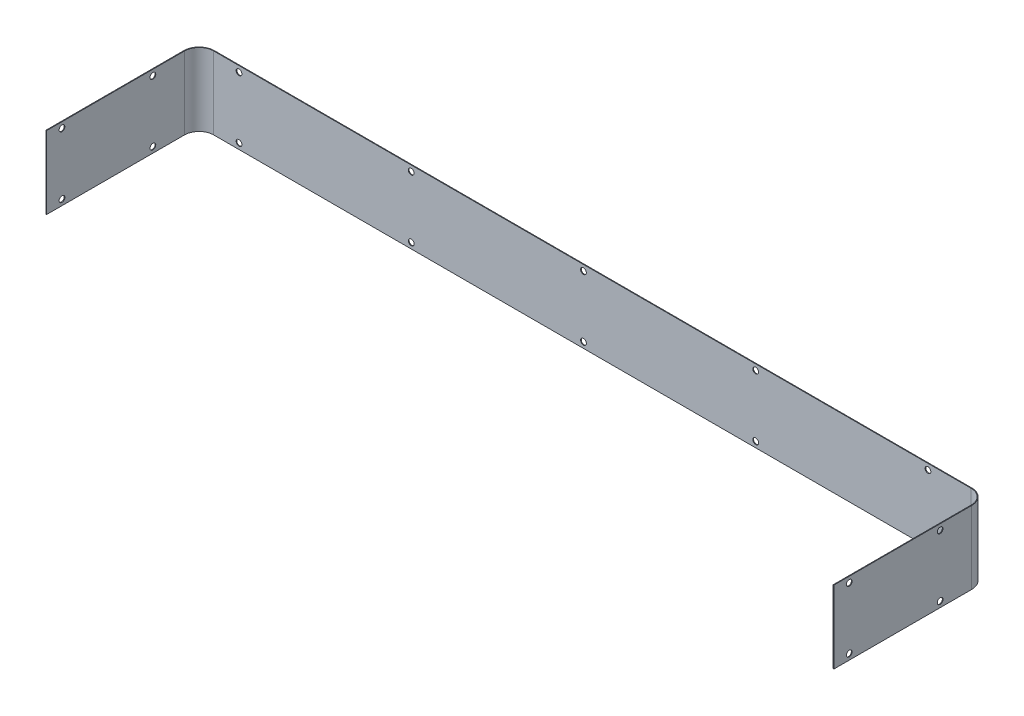
from build123d import *

# Parameters (mm, degrees)
BASE_FLANGE1_DEPTH = 76
SKETCH2_R          = 3
CUT_EXTRUDE1_DEPTH = 843.237234988
SKETCH3_R          = 3
CUT_EXTRUDE2_DEPTH = 10


# Read off the part's stored shape, not the designer's step: Base-Flange1
with BuildPart() as part:
    # Base-Flange1 outline → Base-Flange1 (new body)
    with BuildSketch(Plane(origin=(0, 0, 0), x_dir=(1, 0, 0), z_dir=(0, 1, 0))):
        with BuildLine():
            Line((822.7, 144), (822.7, 0))
            Line((822.7, 0), (823.4, 0))
            Line((823.4, 0), (823.4, 144))
            ThreePointArc((823.4, 144), (818.713708499, 155.313708499), (807.4, 160))
            Line((807.4, 160), (16, 160))
            ThreePointArc((16, 160), (4.686291501, 155.313708499), (0, 144))
            Line((0, 144), (0, 0))
            Line((0, 0), (0.7, 0))
            Line((0.7, 0), (0.7, 144))
            ThreePointArc((0.7, 144), (5.181266248, 154.818733752), (16, 159.3))
            Line((16, 159.3), (807.4, 159.3))
            ThreePointArc((807.4, 159.3), (818.218733752, 154.818733752), (822.7, 144))
        make_face()
    extrude(amount=BASE_FLANGE1_DEPTH)

    # Sketch2 → Cut-Extrude1 (cut, through all)
    with BuildSketch(Plane(origin=(823.4, 0, 0), x_dir=(0, 0, -1), z_dir=(1, 0, 0))):
        with Locations((16, 70)):
            Circle(SKETCH2_R)
        with Locations((111, 70)):
            Circle(SKETCH2_R)
        with Locations(Location((111, 6, 0), (0, 0, 180))):
            Circle(SKETCH2_R)
        with Locations(Location((16, 6, 0), (0, 0, 180))):
            Circle(SKETCH2_R)
    extrude(amount=-CUT_EXTRUDE1_DEPTH, mode=Mode.SUBTRACT)

    # Sketch3 → Cut-Extrude2 (cut)
    with BuildSketch(Plane(origin=(0, 0, -160), x_dir=(-1, 0, 0), z_dir=(0, 0, -1))):
        with Locations((-762.4, 70)):
            Circle(SKETCH3_R)
        with Locations((-582.4, 70)):
            Circle(SKETCH3_R)
        with Locations((-402.4, 70)):
            Circle(SKETCH3_R)
        with Locations((-222.4, 70)):
            Circle(SKETCH3_R)
        with Locations((-42.4, 70)):
            Circle(SKETCH3_R)
        with Locations((137.6, 70)):
            Circle(SKETCH3_R)
        with Locations((317.6, 70)):
            Circle(SKETCH3_R)
        with Locations((317.6, 6)):
            Circle(SKETCH3_R)
        with Locations((137.6, 6)):
            Circle(SKETCH3_R)
        with Locations((-42.4, 6)):
            Circle(SKETCH3_R)
        with Locations((-222.4, 6)):
            Circle(SKETCH3_R)
        with Locations((-402.4, 6)):
            Circle(SKETCH3_R)
        with Locations((-582.4, 6)):
            Circle(SKETCH3_R)
        with Locations((-762.4, 6)):
            Circle(SKETCH3_R)
    extrude(amount=-CUT_EXTRUDE2_DEPTH, mode=Mode.SUBTRACT)


solid = part.part
